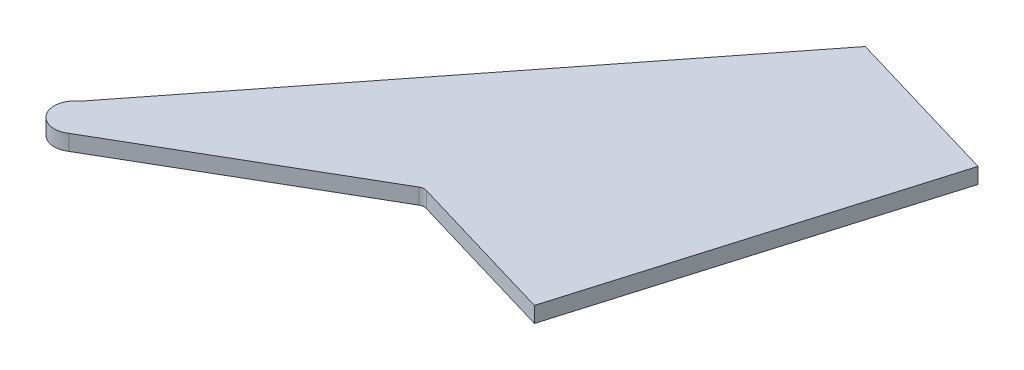
from build123d import *

# Parameters (mm, degrees)
BOSS_EXTRUDE1_DEPTH = 4.7625


with BuildPart() as part:
    # Sketch1 → Boss-Extrude1 (new body)
    with BuildSketch(Plane(origin=(0, 0, 0), x_dir=(1, 0, 0), z_dir=(0, 1, 0))):
        with BuildLine():
            Line((53.854446853, 73.373362576), (102.562489384, 58.945383065))
            Line((102.562489384, 58.945383065), (71.73313232, -45.132782137))
            Line((71.73313232, -45.132782137), (24.990181224, -31.286889228))
            ThreePointArc((24.990181224, -31.286889228), (23.967852385, -31.200180886), (22.994624733, -31.524992416))
            Line((22.994624733, -31.524992416), (-44.326137807, -70.562582621))
            ThreePointArc((-44.326137807, -70.562582621), (-52.787800823, -69.037356261), (-51.262574464, -60.575693244))
            Line((-51.262574464, -60.575693244), (53.854446853, 73.373362576))
        make_face()
    extrude(amount=BOSS_EXTRUDE1_DEPTH)


solid = part.part
